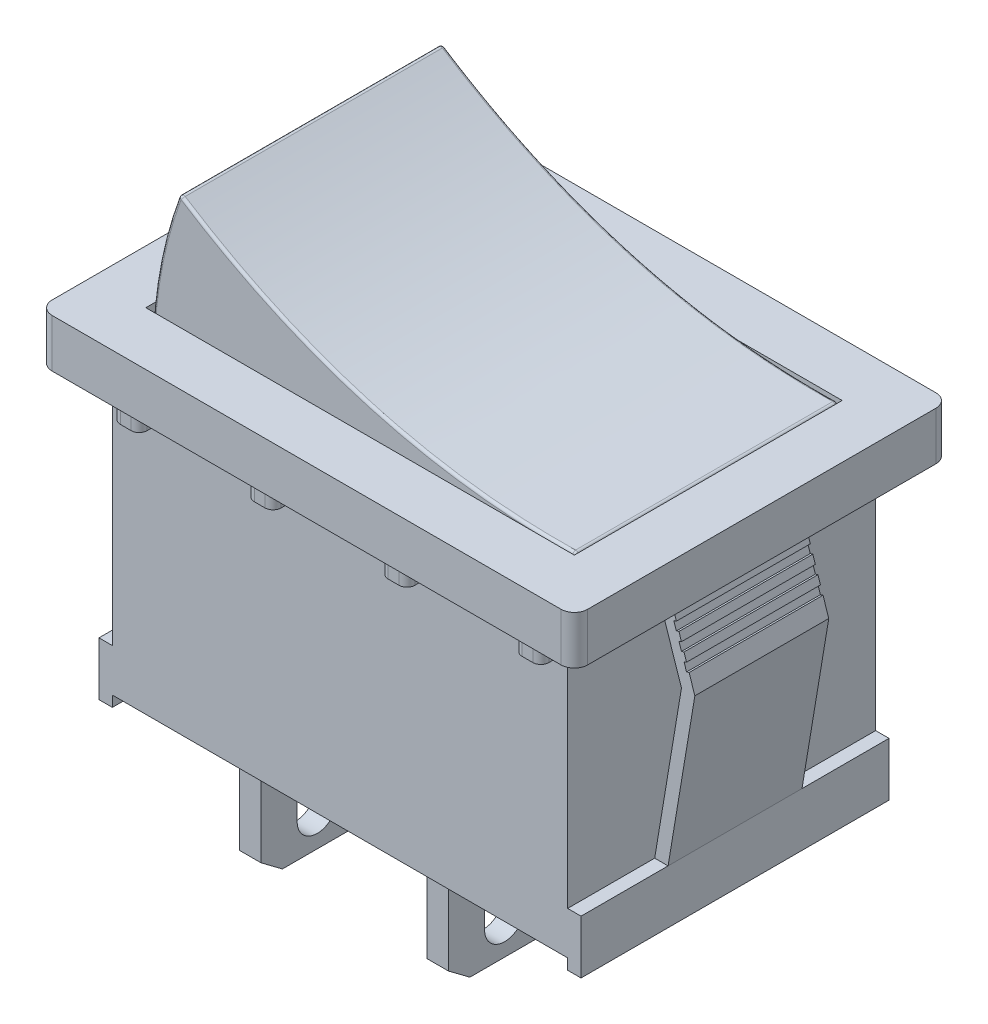
from build123d import *

# Parameters (mm, degrees)
SALIENTE_EXTRUIR1_DEPTH       = 1.8
CROQUIS2_W                    = 16
CROQUIS2_H                    = 10
CORTAR_EXTRUIR1_DEPTH         = 1.5
SALIENTE_EXTRUIR3_DEPTH       = 4.9
SALIENTE_EXTRUIR3_DEPTH_BACK  = 4.9
CROQUIS4_W                    = 0.05
CROQUIS4_H                    = 10
CORTAR_EXTRUIR2_DEPTH         = 1.7
REDONDEO1_R                   = 0.1
REDONDEO2_R                   = 0.1
CROQUIS5_W                    = 17
CROQUIS5_H                    = 11.5
SALIENTE_EXTRUIR4_DEPTH       = 10.5
SALIENTE_EXTRUIR5_DEPTH       = 1.2
CROQUIS7_W                    = 11.5
CROQUIS7_H                    = 2
SALIENTE_EXTRUIR6_DEPTH       = 0.5
CROQUIS8_W                    = 11.5
CROQUIS8_H                    = 2
SALIENTE_EXTRUIR7_DEPTH       = 0.5
CROQUIS9_W                    = 0.8
CROQUIS9_H                    = 4.6
SALIENTE_EXTRUIR8_DEPTH       = 7
CROQUIS10_R                   = 1
CORTAR_EXTRUIR3_DEPTH         = 10
CORTAR_EXTRUIR4_DEPTH         = 10
CROQUIS12_W                   = 17
CROQUIS12_H                   = 3.45
SALIENTE_EXTRUIR9_DEPTH       = 0.1
SALIENTE_EXTRUIR10_DEPTH      = 2.5
SALIENTE_EXTRUIR10_DEPTH_BACK = 2.5
CROQUIS14_W                   = 5
CROQUIS14_H                   = 0.3
CORTAR_EXTRUIR5_DEPTH         = 0.1


with BuildPart() as part:
    # Croquis1 → Saliente-Extruir1 (new body)
    with BuildSketch(Plane(origin=(0, 0, 0), x_dir=(1, 0, 0), z_dir=(0, 1, 0))):
        with BuildLine():
            Line((-9.5, -7), (9.5, -7))
            ThreePointArc((9.5, -7), (9.853553391, -6.853553391), (10, -6.5))
            Line((10, -6.5), (10, 6.5))
            ThreePointArc((10, 6.5), (9.853553391, 6.853553391), (9.5, 7))
            Line((9.5, 7), (-9.5, 7))
            ThreePointArc((-9.5, 7), (-9.853553391, 6.853553391), (-10, 6.5))
            Line((-10, 6.5), (-10, -6.5))
            ThreePointArc((-10, -6.5), (-9.853553391, -6.853553391), (-9.5, -7))
        make_face()
    extrude(amount=SALIENTE_EXTRUIR1_DEPTH)

    # Croquis2 → Cortar-Extruir1 (cut)
    with BuildSketch(Plane(origin=(0, 1.8, 0), x_dir=(1, 0, 0), z_dir=(0, 1, 0))):
        Rectangle(CROQUIS2_W, CROQUIS2_H)
    extrude(amount=-CORTAR_EXTRUIR1_DEPTH, mode=Mode.SUBTRACT)

    # Croquis3 → Saliente-Extruir3 (add, two sides: drawn at the far end of the back side and taken through both)
    with BuildSketch(Plane.XY.offset(-SALIENTE_EXTRUIR3_DEPTH_BACK)):
        with BuildLine():
            Line((8.046935069, 1.793629428), (8.088403313, 0.3))
            Line((8.088403313, 0.3), (-7.875, 0.3))
            ThreePointArc((-7.875, 0.3), (-7.612603193, 3.197144273), (-6.833952566, 6))
            add(Edge.make_bspline(
                [(-6.833952566, 6), (-2.282486721, 3.046687717), (2.677809157, 1.644564193), (8.046935069, 1.793629428)],
                knots=[0, 0, 0, 0, 0.987561785, 0.987561785, 0.987561785, 0.987561785], degree=3))
        make_face()
    extrude(amount=SALIENTE_EXTRUIR3_DEPTH + SALIENTE_EXTRUIR3_DEPTH_BACK)

    # Croquis4 → Cortar-Extruir2 (cut)
    with BuildSketch(Plane(origin=(0, 1.8, 0), x_dir=(1, 0, 0), z_dir=(0, 1, 0))):
        with Locations((7.975, 0)):
            Rectangle(CROQUIS4_W, CROQUIS4_H)
    extrude(amount=-CORTAR_EXTRUIR2_DEPTH, mode=Mode.SUBTRACT)

    # Redondeo1
    redondeo1_edges = [part.edges().sort_by_distance(p)[0] for p in [
        (7.95, 1.791105638, -2.45),
    ]]
    fillet(redondeo1_edges, radius=REDONDEO1_R)

    # Redondeo2
    redondeo2_edges = [part.edges().sort_by_distance(p)[0] for p in [
        (-6.833952566, 6, -2.45),
        (-7.612603193, 3.197144273, 4.9),
        (-7.612603193, 3.197144273, -4.9),
        (7.95, 0.994416132, 4.9),
        (7.95, 0.994416132, -4.9),
        (0.207905221, 2.759609572, 4.9),
        (7.919976694, 1.760269386, 4.9),
        (0.207905221, 2.759609572, -4.9),
        (7.919976694, 1.760269386, -4.9),
    ]]
    fillet(redondeo2_edges, radius=REDONDEO2_R - 0.0004)  # a hair under: the kernel refuses the full size

    # Croquis5 → Saliente-Extruir4 (add)
    with BuildSketch(Plane.XZ):
        Rectangle(CROQUIS5_W, CROQUIS5_H)
    extrude(amount=SALIENTE_EXTRUIR4_DEPTH)

    # Croquis6 → Saliente-Extruir5 (add)
    with BuildSketch(Plane.XZ):
        with BuildLine():
            Line((-8, 5.75), (-7, 5.75))
            Line((-7, 5.75), (-7, 5.95))
            ThreePointArc((-7, 5.95), (-7.087867966, 6.162132034), (-7.3, 6.25))
            Line((-7.3, 6.25), (-7.7, 6.25))
            ThreePointArc((-7.7, 6.25), (-7.912132034, 6.162132034), (-8, 5.95))
            Line((-8, 5.95), (-8, 5.75))
        make_face()
        with BuildLine():
            Line((-3, 5.75), (-2, 5.75))
            Line((-2, 5.75), (-2, 5.95))
            ThreePointArc((-2, 5.95), (-2.087867966, 6.162132034), (-2.3, 6.25))
            Line((-2.3, 6.25), (-2.7, 6.25))
            ThreePointArc((-2.7, 6.25), (-2.912132034, 6.162132034), (-3, 5.95))
            Line((-3, 5.95), (-3, 5.75))
        make_face()
        with BuildLine():
            Line((2, 5.95), (2, 5.75))
            Line((2, 5.75), (3, 5.75))
            Line((3, 5.75), (3, 5.95))
            ThreePointArc((3, 5.95), (2.912132034, 6.162132034), (2.7, 6.25))
            Line((2.7, 6.25), (2.3, 6.25))
            ThreePointArc((2.3, 6.25), (2.087867966, 6.162132034), (2, 5.95))
        make_face()
        with BuildLine():
            Line((7, 5.95), (7, 5.75))
            Line((7, 5.75), (8, 5.75))
            Line((8, 5.75), (8, 5.95))
            ThreePointArc((8, 5.95), (7.912132034, 6.162132034), (7.7, 6.25))
            Line((7.7, 6.25), (7.3, 6.25))
            ThreePointArc((7.3, 6.25), (7.087867966, 6.162132034), (7, 5.95))
        make_face()
        with BuildLine():
            Line((3, -5.75), (2, -5.75))
            Line((2, -5.75), (2, -5.95))
            ThreePointArc((2, -5.95), (2.087867966, -6.162132034), (2.3, -6.25))
            Line((2.3, -6.25), (2.7, -6.25))
            ThreePointArc((2.7, -6.25), (2.912132034, -6.162132034), (3, -5.95))
            Line((3, -5.95), (3, -5.75))
        make_face()
        with BuildLine():
            Line((8, -5.75), (7, -5.75))
            Line((7, -5.75), (7, -5.95))
            ThreePointArc((7, -5.95), (7.087867966, -6.162132034), (7.3, -6.25))
            Line((7.3, -6.25), (7.7, -6.25))
            ThreePointArc((7.7, -6.25), (7.912132034, -6.162132034), (8, -5.95))
            Line((8, -5.95), (8, -5.75))
        make_face()
        with BuildLine():
            Line((-2, -5.75), (-3, -5.75))
            Line((-3, -5.75), (-3, -5.95))
            ThreePointArc((-3, -5.95), (-2.912132034, -6.162132034), (-2.7, -6.25))
            Line((-2.7, -6.25), (-2.3, -6.25))
            ThreePointArc((-2.3, -6.25), (-2.087867966, -6.162132034), (-2, -5.95))
            Line((-2, -5.95), (-2, -5.75))
        make_face()
        with BuildLine():
            Line((-7, -5.75), (-8, -5.75))
            Line((-8, -5.75), (-8, -5.95))
            ThreePointArc((-8, -5.95), (-7.912132034, -6.162132034), (-7.7, -6.25))
            Line((-7.7, -6.25), (-7.3, -6.25))
            ThreePointArc((-7.3, -6.25), (-7.087867966, -6.162132034), (-7, -5.95))
            Line((-7, -5.95), (-7, -5.75))
        make_face()
    extrude(amount=SALIENTE_EXTRUIR5_DEPTH)

    # Croquis7 → Saliente-Extruir6 (add)
    with BuildSketch(Plane(origin=(8.5, 0, 0), x_dir=(0, 0, -1), z_dir=(1, 0, 0))):
        with Locations((0, -10)):
            Rectangle(CROQUIS7_W, CROQUIS7_H)
    extrude(amount=SALIENTE_EXTRUIR6_DEPTH)

    # Croquis8 → Saliente-Extruir7 (add)
    with BuildSketch(Plane.ZY.offset(8.5)):
        with Locations((0, -10)):
            Rectangle(CROQUIS8_W, CROQUIS8_H)
    extrude(amount=SALIENTE_EXTRUIR7_DEPTH)

    # Croquis9 → Saliente-Extruir8 (add)
    with BuildSketch(Plane.XZ.offset(10.5)):
        with Locations((-7, 0)):
            Rectangle(CROQUIS9_W, CROQUIS9_H)
        Rectangle(CROQUIS9_W, CROQUIS9_H)
    extrude(amount=SALIENTE_EXTRUIR8_DEPTH)

    # Croquis10 → Cortar-Extruir3 (cut)
    with BuildSketch(Plane.ZY.offset(7.4)):
        with Locations((0, -12.2)):
            Circle(CROQUIS10_R)
        with BuildLine():
            Line((0.75, -14.75), (0.75, -16.25))
            ThreePointArc((0.75, -16.25), (0, -17), (-0.75, -16.25))
            Line((-0.75, -16.25), (-0.75, -14.75))
            ThreePointArc((-0.75, -14.75), (0, -14), (0.75, -14.75))
        make_face()
    extrude(amount=-CORTAR_EXTRUIR3_DEPTH, mode=Mode.SUBTRACT)

    # Croquis11 → Cortar-Extruir4 (cut)
    with BuildSketch(Plane.ZY.offset(7.4)):
        with BuildLine():
            Line((-2.1, -11.9), (-2.1, -16.9))
            Line((-2.1, -16.9), (-1.3, -17.5))
            Line((-1.3, -17.5), (-2.1, -17.5))
            Line((-2.1, -17.5), (-2.3, -17.5))
            Line((-2.3, -17.5), (-2.3, -11.8))
            Line((-2.3, -11.8), (-2.2, -11.8))
            ThreePointArc((-2.2, -11.8), (-2.129289322, -11.829289322), (-2.1, -11.9))
        make_face()
        with BuildLine():
            Line((2.1, -11.9), (2.1, -16.9))
            Line((2.1, -16.9), (1.3, -17.5))
            Line((1.3, -17.5), (2.1, -17.5))
            Line((2.1, -17.5), (2.3, -17.5))
            Line((2.3, -17.5), (2.3, -11.8))
            Line((2.3, -11.8), (2.2, -11.8))
            ThreePointArc((2.2, -11.8), (2.129289322, -11.829289322), (2.1, -11.9))
        make_face()
    extrude(amount=-CORTAR_EXTRUIR4_DEPTH, mode=Mode.SUBTRACT)

    # Croquis12 → Saliente-Extruir9 (add)
    with BuildSketch(Plane.XZ.offset(10.5)):
        with Locations((0, 4.025)):
            Rectangle(CROQUIS12_W, CROQUIS12_H)
    extrude(amount=SALIENTE_EXTRUIR9_DEPTH)

    # Croquis13 → Saliente-Extruir10 (add, two sides: drawn at the far end of the back side and taken through both)
    with BuildSketch(Plane.XY.offset(-SALIENTE_EXTRUIR10_DEPTH_BACK)):
        Polygon((8.5, 0), (9, 0), (10, -3), (9, -9), (8.5, -9), (9.5, -3), align=None)
        Polygon((-10, -3), (-9, -9), (-8.5, -9), (-9.5, -3), (-8.5, 0), (-9, 0), align=None)
    extrude(amount=SALIENTE_EXTRUIR10_DEPTH + SALIENTE_EXTRUIR10_DEPTH_BACK)

    # Croquis14 → Cortar-Extruir5 (cut)
    with BuildSketch(Plane(origin=(8.1, 2.7, 0), x_dir=(0, 0, -1), z_dir=(0.9486832980505138, 0.31622776601683816, 0))):
        with Locations((0, -3.977188724)):
            Rectangle(CROQUIS14_W, CROQUIS14_H)
        with Locations((0, -3.377188724)):
            Rectangle(CROQUIS14_W, CROQUIS14_H)
        with Locations((0, -4.577188724)):
            Rectangle(CROQUIS14_W, CROQUIS14_H)
        with Locations((0, -5.177188724)):
            Rectangle(CROQUIS14_W, CROQUIS14_H)
    cortar_extruir5 = extrude(amount=-CORTAR_EXTRUIR5_DEPTH, mode=Mode.SUBTRACT)

    # Simetría1: Cortar-Extruir5 across plane
    add(cortar_extruir5.mirror(Plane(origin=(0, 0, 0), x_dir=(0, 0, 1), z_dir=(1, 0, 0))), mode=Mode.SUBTRACT)


solid = part.part
